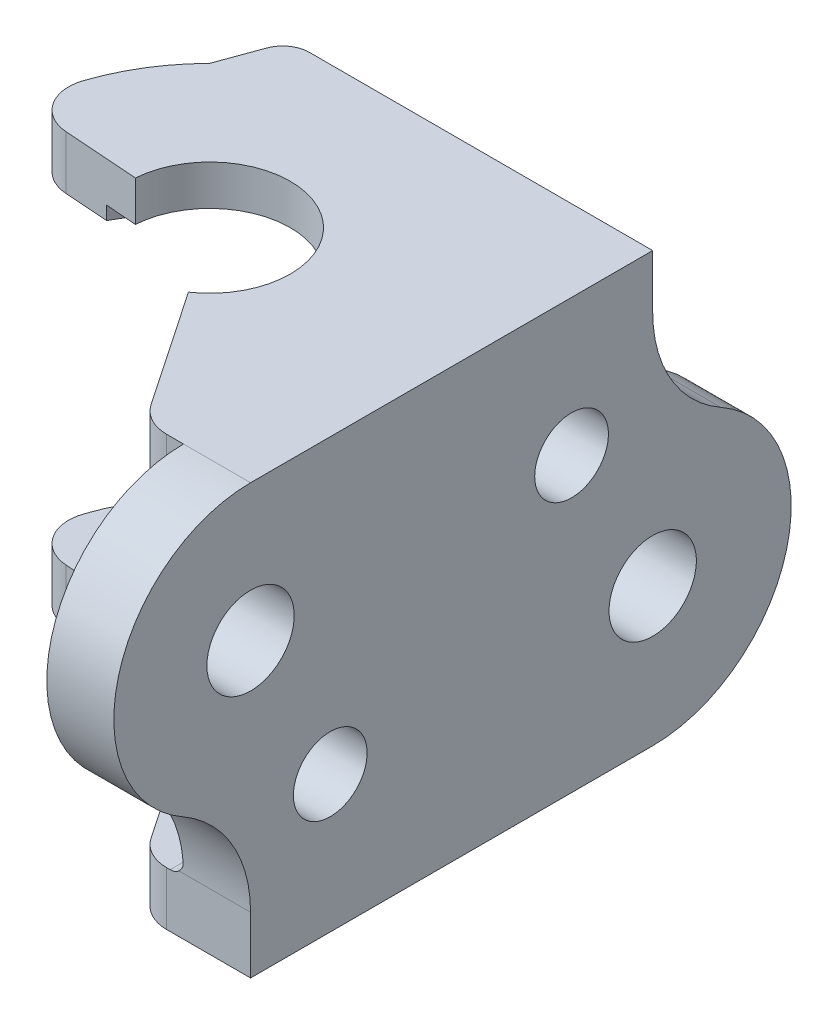
from build123d import *
from build123d.topology import SkipClean

# Parameters (mm, degrees)
BOSS_EXTRUDE1_DEPTH     = 4
SKETCH3_W               = 5
SKETCH3_H               = 30
BOSS_EXTRUDE3_DEPTH     = 24
BOSS_EXTRUDE5_DEPTH     = 5
SKETCH7_3_R             = 3.25755
CUT_EXTRUDE3_DEPTH      = 5
FILLET3_R               = 10
CUT_EXTRUDE4_DEPTH      = 25
CUT_EXTRUDE4_DEPTH_BACK = 1
CUT_EXTRUDE5_DEPTH      = 50.494221145
CUT_EXTRUDE5_DEPTH_BACK = 50.494221145
SKETCH9_R               = 2.75
FILLET4_R               = 1
FILLET5_R               = 3
BOSS_EXTRUDE6_DEPTH     = 4
FILLET6_R               = 2
BOSS_EXTRUDE7_DEPTH     = 4


with BuildPart() as part:
    # Sketch2 → Boss-Extrude1 (new body)
    with BuildSketch(Plane(origin=(0, 0, 0), x_dir=(1, 0, 0), z_dir=(0, 1, 0))):
        with BuildLine():
            Line((18.000912404, -14.946929254), (18.000912404, 15.053070746))
            Line((18.000912404, 15.053070746), (0.039090451, 15.053070746))
            ThreePointArc((0.039090451, 15.053070746), (-10.199781301, 11.024824414), (-14.94907539, 1.099832277))
            Line((-14.94907539, 1.099832277), (-5.983249792, 0.448020006))
            ThreePointArc((-5.983249792, 0.448020006), (3.000957071, 5.20912276), (3.369824569, -4.951979994))
            Line((3.369824569, -4.951979994), (10.151696986, -14.946929254))
            Line((10.151696986, -14.946929254), (18.000912404, -14.946929254))
        make_face()
    boss_extrude1 = extrude(amount=BOSS_EXTRUDE1_DEPTH)

    # Sketch3 → Boss-Extrude3 (add)
    with BuildSketch(Plane(origin=(0, 4, 0), x_dir=(1, 0, 0), z_dir=(0, 1, 0))):
        with Locations((15.500912404, 0.053070746)):
            Rectangle(SKETCH3_W, SKETCH3_H)
    extrude(amount=BOSS_EXTRUDE3_DEPTH)

    # Mirror1: Boss-Extrude1 across plane
    add(boss_extrude1.mirror(Plane.ZX.offset(16)))

    # Sketch7 → Boss-Extrude5 (add)
    with BuildSketch(Plane.ZY.offset(-13.000912404)):
        with BuildLine():
            Line((-15.053070746, 0), (-15.053070746, 4))
            Line((-15.053070746, 4), (-15.053070746, 7.075913265))
            ThreePointArc((-15.053070746, 7.075913265), (-18.310620746, 10.333463265), (-15.053070746, 13.591013265))
            Line((-15.053070746, 13.591013265), (-15.053070746, 20.666926531))
            ThreePointArc((-15.053070746, 20.666926531), (-25.386534011, 10.333463265), (-15.053070746, 0))
        make_face()
        with BuildLine():
            ThreePointArc((25.146929254, 21.8), (22.159418422, 29.012489168), (14.946929254, 32))
            Line((14.946929254, 32), (14.946929254, 28))
            Line((14.946929254, 28), (14.946929254, 25.05755))
            ThreePointArc((14.946929254, 25.05755), (17.250364949, 24.103435695), (18.204479254, 21.8))
            ThreePointArc((18.204479254, 21.8), (17.250364949, 19.496564305), (14.946929254, 18.54245))
            Line((14.946929254, 18.54245), (14.946929254, 11.6))
            ThreePointArc((14.946929254, 11.6), (22.159418422, 14.587510832), (25.146929254, 21.8))
        make_face()
        with BuildLine():
            Line((14.946929254, 28), (14.946929254, 32))
            ThreePointArc((14.946929254, 32), (4.746929254, 21.8), (14.946929254, 11.6))
            Line((14.946929254, 11.6), (14.946929254, 18.54245))
            ThreePointArc((14.946929254, 18.54245), (11.689379254, 21.8), (14.946929254, 25.05755))
            Line((14.946929254, 25.05755), (14.946929254, 28))
        make_face()
    extrude(amount=-BOSS_EXTRUDE5_DEPTH)

    # Sketch7<3> → Cut-Extrude3 (cut)
    with SkipClean():  # the faces are left unmerged after this step: merging them gives an invalid solid
        with BuildSketch(Plane.ZY.offset(-13.000912404)):
            with Locations((14.946929254, 21.8)):
                Circle(SKETCH7_3_R)
            with Locations((-15.053070746, 10.333463265)):
                Circle(SKETCH7_3_R)
        extrude(amount=-CUT_EXTRUDE3_DEPTH, mode=Mode.SUBTRACT)

    # Fillet3
    # the kernel refuses this fillet: 10 mm, written as the material it adds along each edge
    with BuildSketch(Plane(origin=(13.000912404, 20.666926531, -15.053070746), x_dir=(0, -0.25425566101904284, -0.9671370424297528), z_dir=(1, 0, 0))) as fillet3_piece_1:
        with BuildLine():
            CenterArc((7.797239676, 9.671370424), FILLET3_R, 194.729484057, 60.541031886)
            Line((-1.874130748, 7.128813814), (0, 0))
            ThreePointArc((0, 0), (2.627341533, 0.339588165), (5.254683066, 0))
        make_face()
    extrude(amount=5)
    with BuildSketch(Plane(origin=(13.000912404, 11.6, 14.946929254), x_dir=(0, -1, 0), z_dir=(1, 0, 0))) as fillet3_piece_2:
        with BuildLine():
            CenterArc((7.351068344, -10), FILLET3_R, 90, 60.326985198)
            ThreePointArc((-1.337579351, -5.04950495), (-0.340063626, -2.611829759), (0, 0))
            Line((0, 0), (7.351068344, 0))
        make_face()
    extrude(amount=5)

    # Sketch8 → Cut-Extrude4 (cut, two sides: drawn at the far end of the back side and taken through both)
    with SkipClean():  # the faces are left unmerged after this step: merging them gives an invalid solid
        with BuildSketch(Plane(origin=(0, 4, 0), x_dir=(1, 0, 0), z_dir=(0, 1, 0)).offset(-CUT_EXTRUDE4_DEPTH_BACK)):
            with BuildLine():
                Line((-7.47930432, 0.556782628), (-5.983249792, 0.448020006))
                ThreePointArc((-5.983249792, 0.448020006), (3.000957071, 5.20912276), (3.369824569, -4.951979994))
                Line((3.369824569, -4.951979994), (4.217763535, -6.201650648))
                ThreePointArc((4.217763535, -6.201650648), (5.494951676, -5.104459431), (6.495190528, -3.75))
                ThreePointArc((6.495190528, -3.75), (7.244443697, -1.941142838), (7.5, 0))
                ThreePointArc((7.5, 0), (1.941142838, 7.244443697), (-6.495190528, 3.75))
                ThreePointArc((-6.495190528, 3.75), (-7.167341617, 2.208894325), (-7.47930432, 0.556782628))
            make_face()
            with BuildLine():
                Line((-8.304173093, 0.616750289), (-7.47930432, 0.556782628))
                ThreePointArc((-7.47930432, 0.556782628), (-7.167341617, 2.208894325), (-6.495190528, 3.75))
                Line((-6.495190528, 3.75), (-8.304173093, 0.616750289))
            make_face()
            with BuildLine():
                ThreePointArc((4.217763535, -6.201650648), (-3.752135014, -6.49395741), (-7.47930432, 0.556782628))
                Line((-7.47930432, 0.556782628), (-8.304173093, 0.616750289))
                Line((-8.304173093, 0.616750289), (-11.199802547, -4.398627047))
                Line((-11.199802547, -4.398627047), (1.534433746, -12.342282792))
                Line((1.534433746, -12.342282792), (4.683468483, -6.887994631))
                Line((4.683468483, -6.887994631), (4.217763535, -6.201650648))
            make_face()
            with BuildLine():
                ThreePointArc((6.495190528, -3.75), (5.494951676, -5.104459431), (4.217763535, -6.201650648))
                Line((4.217763535, -6.201650648), (4.683468483, -6.887994631))
                Line((4.683468483, -6.887994631), (6.495190528, -3.75))
            make_face()
            with BuildLine():
                Line((3.369824569, -4.951979994), (-5.983249792, 0.448020006))
                Line((-5.983249792, 0.448020006), (-7.47930432, 0.556782628))
                ThreePointArc((-7.47930432, 0.556782628), (-3.752135014, -6.49395741), (4.217763535, -6.201650648))
                Line((4.217763535, -6.201650648), (3.369824569, -4.951979994))
            make_face()
        extrude(amount=CUT_EXTRUDE4_DEPTH + CUT_EXTRUDE4_DEPTH_BACK, mode=Mode.SUBTRACT)

    # Sketch9 → Cut-Extrude5 (cut, two sides: drawn at the far end of the back side and taken through both)
    with BuildSketch(Plane.ZY.offset(-13.000912404).offset(-CUT_EXTRUDE5_DEPTH_BACK)):
        with Locations((9, 10.2)):
            Circle(SKETCH9_R)
        with Locations((-9, 21.8)):
            Circle(SKETCH9_R)
    extrude(amount=CUT_EXTRUDE5_DEPTH + CUT_EXTRUDE5_DEPTH_BACK, mode=Mode.SUBTRACT)

    # Fillet4
    fillet4_edges = [part.edges().sort_by_distance(p)[0] for p in [
        (13.000912404, 4, -0.053070746),
        (13.000912404, 28, -0.053070746),
    ]]
    fillet(fillet4_edges, radius=FILLET4_R)

    # Fillet5
    fillet5_edges = [part.edges().sort_by_distance(p)[0] for p in [
        (10.151696986, 2, 14.946929254),
        (-14.94907539, 2, -1.099832277),
        (10.151696986, 30, 14.946929254),
        (-14.94907539, 30, -1.099832277),
    ]]
    fillet(fillet5_edges, radius=FILLET5_R)

    # Sketch10 → Boss-Extrude6 (add)
    with BuildSketch(Plane.XZ):
        with BuildLine():
            ThreePointArc((0.039090451, -15.053070746), (-5.733491903, -13.900038334), (-10.620178824, -10.617892431))
            Line((-10.620178824, -10.617892431), (-9.005905934, -15.053070746))
            Line((-9.005905934, -15.053070746), (0.039090451, -15.053070746))
        make_face()
    extrude(amount=-BOSS_EXTRUDE6_DEPTH)

    # Fillet6
    fillet6_edges = [part.edges().sort_by_distance(p)[0] for p in [
        (-9.005905934, 2, -15.053070746),
    ]]
    fillet(fillet6_edges, radius=FILLET6_R)

    # Sketch11 → Boss-Extrude7 (add)
    with BuildSketch(Plane(origin=(0, 32, 0), x_dir=(1, 0, 0), z_dir=(0, 1, 0))):
        with BuildLine():
            Line((-9.484876099, 13.737111032), (-10.620178824, 10.617892431))
            ThreePointArc((-10.620178824, 10.617892431), (-5.733491903, 13.900038334), (0.039090451, 15.053070746))
            Line((0.039090451, 15.053070746), (-7.605490857, 15.053070746))
            ThreePointArc((-7.605490857, 15.053070746), (-8.75264373, 14.691374834), (-9.484876099, 13.737111032))
        make_face()
    extrude(amount=-BOSS_EXTRUDE7_DEPTH)


solid = part.part
